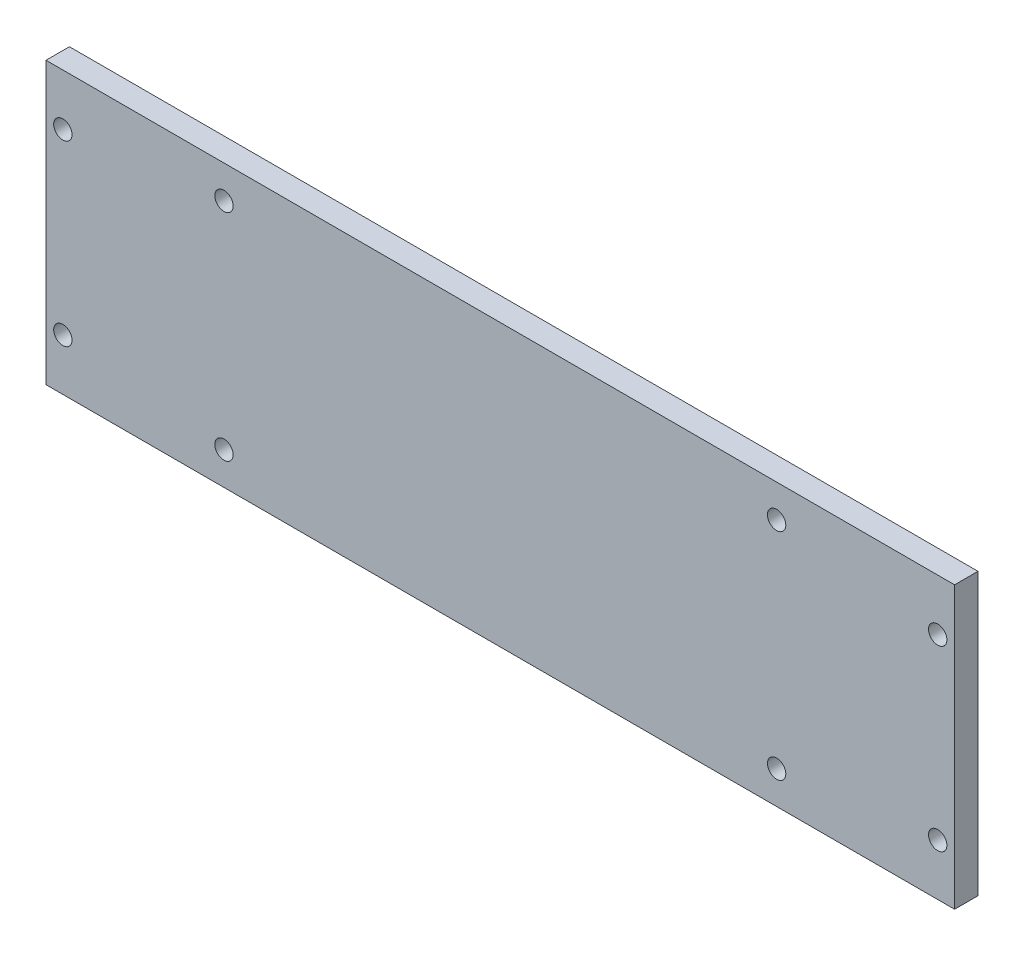
from build123d import *

# Parameters (mm, degrees)
SKETCH1_W              = 246.38
SKETCH1_H              = 76.2
BOSS_EXTRUDE1_DEPTH    = 6.35
F_10_CLEARANCE_HOLE1_D = 4.9784


with BuildPart() as part:
    # Sketch1 → Boss-Extrude1 (new body)
    with BuildSketch(Plane.XY):
        Rectangle(SKETCH1_W, SKETCH1_H)
    extrude(amount=BOSS_EXTRUDE1_DEPTH)

    # #10 Clearance Hole1 (through all)
    with Locations(Plane.XY.offset(6.35)):
        with Locations((-74.93, 29.21), (-74.93, -29.21), (74.93, 29.21), (74.93, -29.21), (-118.618, 24.13), (-118.618, -24.13), (118.618, 24.13), (118.618, -24.13)):
            Hole(F_10_CLEARANCE_HOLE1_D / 2)


solid = part.part
